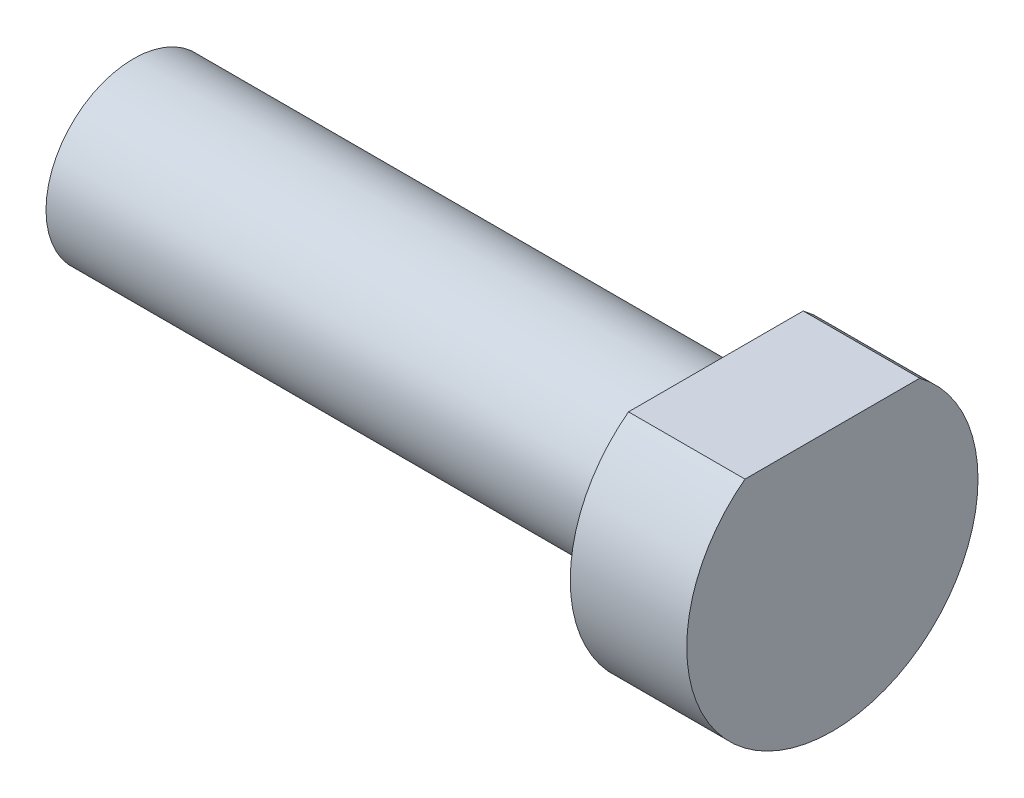
from build123d import *

# Parameters (mm, degrees)
SKETCH2_W          = 2
SKETCH2_H          = 5
CUT_EXTRUDE1_DEPTH = 1


with BuildPart() as part:
    # Sketch1 → Revolve1 (revolve)
    with BuildSketch(Plane.XY):
        Polygon((0, 0), (0, -1.5), (10, -1.5), (10, -2.5), (12, -2.5), (12, 0), align=None)
    revolve(axis=Axis((12, 0, 0), (-1, 0, 0)))

    # Sketch2 → Cut-Extrude1 (cut)
    with BuildSketch(Plane(origin=(0, 3, 0), x_dir=(1, 0, 0), z_dir=(0, 1, 0))):
        with Locations((11, 0)):
            Rectangle(SKETCH2_W, SKETCH2_H)
    extrude(amount=-CUT_EXTRUDE1_DEPTH, mode=Mode.SUBTRACT)


solid = part.part
